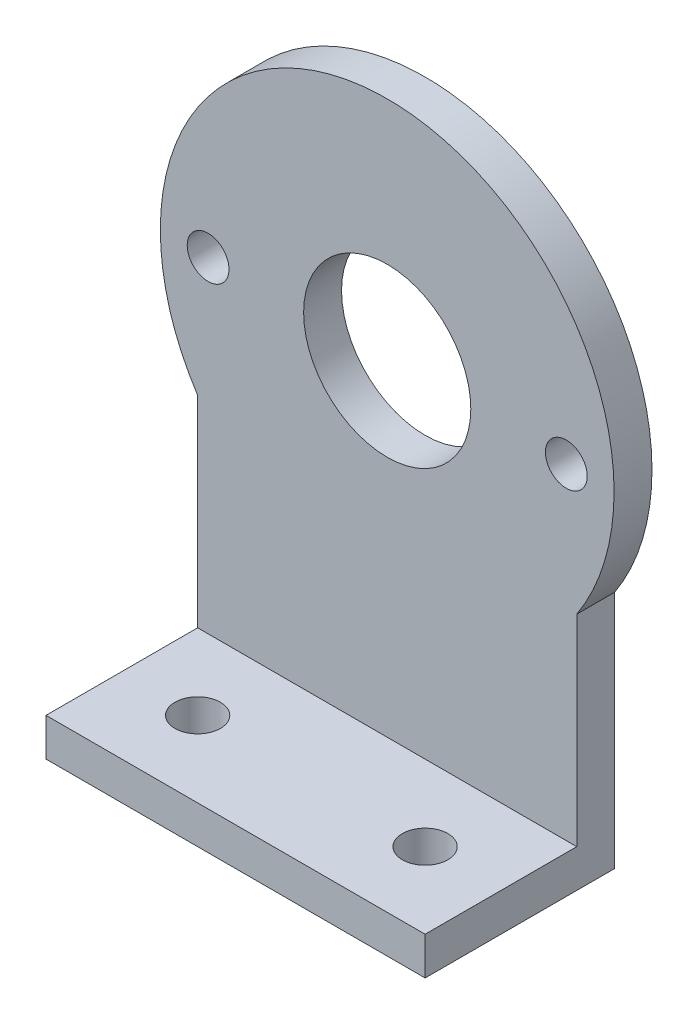
from build123d import *

# Parameters (mm, degrees)
SKETCH1_R           = 19
SKETCH1_W           = 31.75
SKETCH1_H           = 20.04044182
BOSS_EXTRUDE1_DEPTH = 3.175
SKETCH3_R           = 7
CUT_EXTRUDE1_DEPTH  = 37.057052362
SKETCH4_W           = 31.75
SKETCH4_H           = 3.175
BOSS_EXTRUDE2_DEPTH = 12.7
SKETCH5_R           = 1.905
CUT_EXTRUDE2_DEPTH  = 53.508748319
SKETCH6_R           = 1.75
CUT_EXTRUDE3_DEPTH  = 39.096199285


with BuildPart() as part:
    # Sketch1 → Boss-Extrude1 (new body)
    with BuildSketch(Plane.XY):
        Circle(SKETCH1_R)
        with Locations((0, -20.45977909)):
            Rectangle(SKETCH1_W, SKETCH1_H)
    extrude(amount=BOSS_EXTRUDE1_DEPTH)

    # Sketch3 → Cut-Extrude1 (cut, through all)
    with BuildSketch(Plane.XY.offset(3.175)):
        Circle(SKETCH3_R)
    extrude(amount=-CUT_EXTRUDE1_DEPTH, mode=Mode.SUBTRACT)

    # Sketch4 → Boss-Extrude2 (add)
    with BuildSketch(Plane.XY.offset(3.175)):
        with Locations((0, -28.8925)):
            Rectangle(SKETCH4_W, SKETCH4_H)
    extrude(amount=BOSS_EXTRUDE2_DEPTH)

    # Sketch5 → Cut-Extrude2 (cut, through all)
    with BuildSketch(Plane(origin=(0, -27.305, 0), x_dir=(1, 0, 0), z_dir=(0, 1, 0))):
        with Locations((-9.525, -9.525)):
            Circle(SKETCH5_R)
        with Locations((9.525, -9.525)):
            Circle(SKETCH5_R)
    extrude(amount=-CUT_EXTRUDE2_DEPTH, mode=Mode.SUBTRACT)

    # Sketch6 → Cut-Extrude3 (cut, through all)
    with BuildSketch(Plane.XY.offset(3.175)):
        with Locations((15, 0)):
            Circle(SKETCH6_R)
        with Locations((-15, 0)):
            Circle(SKETCH6_R)
    extrude(amount=-CUT_EXTRUDE3_DEPTH, mode=Mode.SUBTRACT)


solid = part.part
